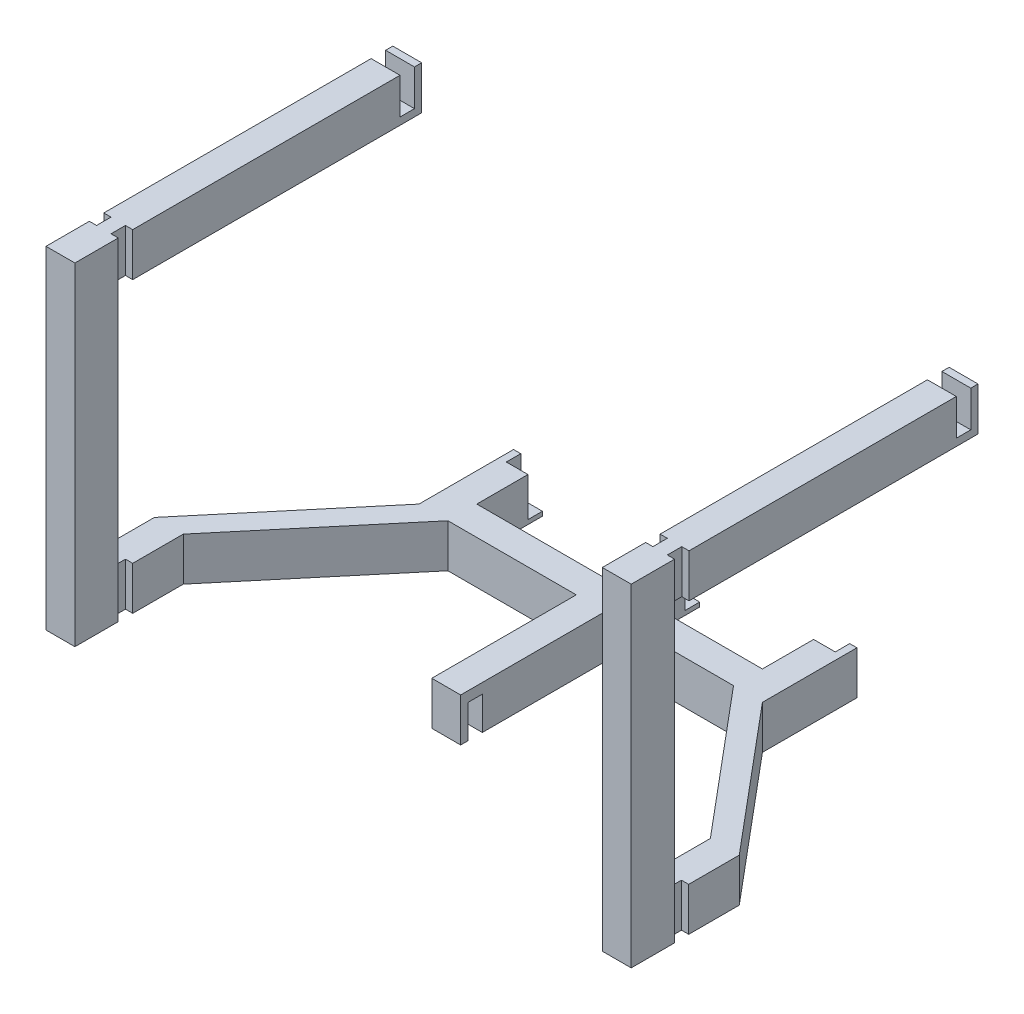
from build123d import *

# Parameters (mm, degrees)
BOSS_EXTRUDE1_DEPTH   = 30
SKETCH2_W             = 10
SKETCH2_H             = 25
CUT_EXTRUDE1_DEPTH    = 20
SKETCH4_W             = 20
SKETCH4_H             = 30
BOSS_EXTRUDE2_DEPTH   = 200
BOSS_EXTRUDE3_DEPTH   = 30
CUT_EXTRUDE2_REACH    = 341.246
CUT_EXTRUDE2_START    = -5
SKETCH7_W             = 10
SKETCH7_H             = 27
MIRROR2_START         = -200
MIRROR2_DEPTH         = 30
MIRROR2_2_OUTLINE_W   = 10
MIRROR2_2_OUTLINE_H   = 10
MIRROR2_2_OUTLINE_W_2 = 15
MIRROR2_2_DEPTH       = 3
SKETCH8_W             = 20
SKETCH8_H             = 5
BOSS_EXTRUDE4_DEPTH   = 30
BOSS_EXTRUDE4_2_DEPTH = 30
SKETCH9_W             = 20
SKETCH9_H             = 30
BOSS_EXTRUDE5_DEPTH   = 200
BOSS_EXTRUDE6_START   = 365
SKETCH10_W            = 10
SKETCH10_H            = 5
BOSS_EXTRUDE6_DEPTH   = 20
SKETCH11_W            = 10
SKETCH11_H            = 23
CUT_EXTRUDE3_DEPTH    = 20


# Read off the part's stored shape, not the designer's step: Mirror2
with BuildPart() as part:
    # Sketch1 → Boss-Extrude1 (new body)
    with BuildSketch(Plane(origin=(0, 0, 0), x_dir=(1, 0, 0), z_dir=(0, 1, 0))):
        Polygon((15, 30), (20, 30), (20, 0), (0, 0), (0, 30), (5, 30), (5, 40), (0, 40), (0, 240), (20, 240), (20, 40), (15, 40), align=None)
    extrude(amount=BOSS_EXTRUDE1_DEPTH)

    # Sketch2 → Cut-Extrude1 (cut)
    with BuildSketch(Plane.ZY):
        with Locations((-230, 17.5)):
            Rectangle(SKETCH2_W, SKETCH2_H)
    extrude(amount=-CUT_EXTRUDE1_DEPTH, mode=Mode.SUBTRACT)

    # Sketch4 → Boss-Extrude2 (add)
    with BuildSketch(Plane.XZ):
        with Locations((10, -15)):
            Rectangle(SKETCH4_W, SKETCH4_H)
    extrude(amount=BOSS_EXTRUDE2_DEPTH)


with BuildPart() as body_2:
    # Sketch5 → Boss-Extrude3 (new body)
    with BuildSketch(Plane.XZ.offset(200)):
        Polygon((5, -30), (15, -30), (15, -40), (20, -40), (20, -75), (103.562389259, -174.585777605), (192.391233937, -174.585777605), (192.391233937, -74.585777605), (202.391233937, -74.585777605), (202.391233937, -240), (192.391233937, -240), (192.391233937, -194.585777605), (103.562389259, -194.585777605), (103.562389259, -240), (83.562389259, -240), (83.562389259, -174.585777605), (0, -75), (0, -40), (5, -40), align=None)
    extrude(amount=-BOSS_EXTRUDE3_DEPTH)

    # Cut-Extrude2: up to this face of the body (flat: up to its plane)
    cut_extrude2_end = Plane(body_2.part.faces().sort_by_distance((202.391233937, -185, -157.292888803))[0])
    # Sketch7 → Cut-Extrude2 (cut, up to the picked face)
    with BuildSketch(Plane.ZY.offset(-83.562389259).offset(CUT_EXTRUDE2_START), mode=Mode.PRIVATE) as cut_extrude2_sk1:
        with Locations((-235, -183.5)):
            Rectangle(SKETCH7_W, SKETCH7_H)
    cut_extrude2_tool1 = split(extrude(cut_extrude2_sk1.sketch, amount=-CUT_EXTRUDE2_REACH, mode=Mode.PRIVATE), bisect_by=cut_extrude2_end, keep=Keep.BOTH, mode=Mode.PRIVATE)
    add(cut_extrude2_tool1.solids().sort_by(Axis((88.562389, -183.5, -235), (1, 0, 0)))[0], mode=Mode.SUBTRACT)

    # Mirror2 outline → Mirror2 (add)
    with BuildSketch(Plane(origin=(0, 0, 0), x_dir=(1, 0, 0), z_dir=(0, 1, 0)).offset(MIRROR2_START)):
        Polygon((384.782467874, 75), (384.782467874, 40), (389.782467874, 40), (389.782467874, 30), (399.782467874, 30), (399.782467874, 40), (404.782467874, 40), (404.782467874, 75), (321.220078615, 174.585777605), (321.220078615, 240), (316.220078615, 240), (316.220078615, 230), (301.220078615, 230), (301.220078615, 194.585777605), (212.391233937, 194.585777605), (212.391233937, 230), (202.391233937, 230), (202.391233937, 74.585777605), (212.391233937, 74.585777605), (212.391233937, 174.585777605), (301.220078615, 174.585777605), align=None)
    extrude(amount=MIRROR2_DEPTH)

    # Mirror2 2 outline → Mirror2 2 (add)
    with BuildSketch(Plane(origin=(0, 0, 0), x_dir=(1, 0, 0), z_dir=(0, 1, 0)).offset(MIRROR2_START)):
        with Locations((207.391233937, 235)):
            Rectangle(MIRROR2_2_OUTLINE_W, MIRROR2_2_OUTLINE_H)
        with Locations((308.720078615, 235)):
            Rectangle(MIRROR2_2_OUTLINE_W_2, MIRROR2_2_OUTLINE_H)
    extrude(amount=MIRROR2_2_DEPTH)



with BuildPart() as body_3:
    # Sketch8 → Boss-Extrude4 (new body)
    with BuildSketch(Plane(origin=(0, 30, 0), x_dir=(1, 0, 0), z_dir=(0, 1, 0))):
        with Locations((395, 237.5)):
            Rectangle(SKETCH8_W, SKETCH8_H)
    extrude(amount=-BOSS_EXTRUDE4_DEPTH)


with BuildPart() as body_4:
    # Sketch8 → Boss-Extrude4 2 (new body)
    with BuildSketch(Plane(origin=(0, 30, 0), x_dir=(1, 0, 0), z_dir=(0, 1, 0))):
        Polygon((405, 30), (400, 30), (400, 40), (405, 40), (405, 225), (385, 225), (385, 40), (390, 40), (390, 30), (385, 30), (385, 0), (405, 0), align=None)
    extrude(amount=-BOSS_EXTRUDE4_2_DEPTH)


with BuildPart() as body_2_1:
    add(body_2.part)

    add(body_4.part)  # Boss-Extrude5 merges body 4
    # Sketch9 → Boss-Extrude5 (add)
    with BuildSketch(Plane.XZ):
        with Locations((395, -15)):
            Rectangle(SKETCH9_W, SKETCH9_H)
    extrude(amount=BOSS_EXTRUDE5_DEPTH)


    add(body_3.part)  # Boss-Extrude6 merges body 3
    # Sketch10 → Boss-Extrude6 (add)
    with BuildSketch(Plane(origin=(20, 0, 0), x_dir=(0, 0, -1), z_dir=(1, 0, 0)).offset(BOSS_EXTRUDE6_START)):
        with Locations((230, 2.5)):
            Rectangle(SKETCH10_W, SKETCH10_H)
    extrude(amount=BOSS_EXTRUDE6_DEPTH)

    # Sketch11 → Cut-Extrude3 (cut)
    with BuildSketch(Plane.ZY.offset(-192.391233937)):
        with Locations((-84.585777605, -188.5)):
            Rectangle(SKETCH11_W, SKETCH11_H)
    extrude(amount=-CUT_EXTRUDE3_DEPTH, mode=Mode.SUBTRACT)


solid = Compound([part.part, body_2_1.part])
